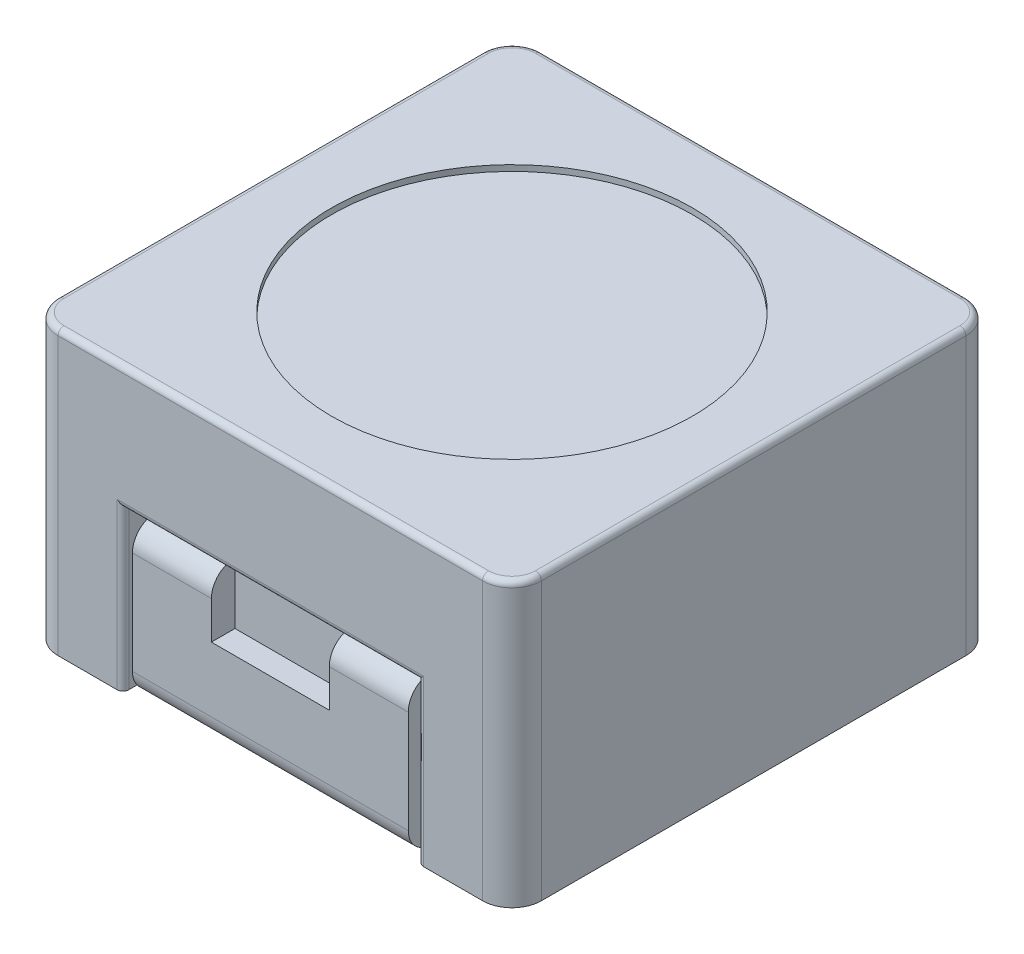
from build123d import *

# Parameters (mm, degrees)
SKETCH_1_W           = 4.1
SKETCH_1_H           = 4.1
EXTRUDE_1_DEPTH      = 2.4
SKETCH_2_W           = 2.5
SKETCH_2_H           = 2.7
CUT_EXTRUDE_1_DEPTH  = 0.2
SKETCH_3_W           = 2.5
SKETCH_3_H           = 0.3
CUT_EXTRUDE_2_DEPTH  = 1.2
SKETCH_4_W           = 2.5
SKETCH_4_H           = 2.7
CUT_EXTRUDE_3_DEPTH  = 0.2
SKETCH_5_W           = 2.5
SKETCH_5_H           = 0.4
CUT_EXTRUDE_4_DEPTH  = 1.2
SKETCH_6_R           = 1.531140145
CUT_EXTRUDE_6_DEPTH  = 0.05
FILLET_3_R           = 0.05
FILLET_4_R           = 0.25
EXTRUDE_2_DEPTH      = 0.2
EXTRUDE_2_DEPTH_BACK = 1.15
EXTRUDE_3_DEPTH      = 0.2
EXTRUDE_3_DEPTH_BACK = 1.15
FILLET_7_R           = 0.2
FILLET_8_R           = 0.2


# Some blends are built 0.0001 mm under size
with BuildPart() as part:
    # Эскиз1 → Бобышка-Вытянуть1 (new body)
    with BuildSketch(Plane(origin=(0, 0, 0), x_dir=(1, 0, 0), z_dir=(0, 1, 0))):
        Rectangle(SKETCH_1_W, SKETCH_1_H)
    extrude(amount=EXTRUDE_1_DEPTH)

    # Эскиз2 → Вырез-Вытянуть1 (cut)
    with BuildSketch(Plane.XY.offset(2.05)):
        Rectangle(SKETCH_2_W, SKETCH_2_H)
    extrude(amount=-CUT_EXTRUDE_1_DEPTH, mode=Mode.SUBTRACT)

    # Эскиз3 → Вырез-Вытянуть2 (cut)
    with BuildSketch(Plane.XY.offset(1.85)):
        Rectangle(SKETCH_3_W, SKETCH_3_H)
    extrude(amount=-CUT_EXTRUDE_2_DEPTH, mode=Mode.SUBTRACT)

    # Эскиз4 → Вырез-Вытянуть3 (cut)
    with BuildSketch(Plane(origin=(0, 0, -2.05), x_dir=(-1, 0, 0), z_dir=(0, 0, -1))):
        Rectangle(SKETCH_4_W, SKETCH_4_H)
    extrude(amount=-CUT_EXTRUDE_3_DEPTH, mode=Mode.SUBTRACT)

    # Эскиз5 → Вырез-Вытянуть4 (cut)
    with BuildSketch(Plane(origin=(0, 0, -1.85), x_dir=(-1, 0, 0), z_dir=(0, 0, -1))):
        Rectangle(SKETCH_5_W, SKETCH_5_H)
    extrude(amount=-CUT_EXTRUDE_4_DEPTH, mode=Mode.SUBTRACT)

    # Эскиз6 → Вырез-Вытянуть6 (cut)
    with BuildSketch(Plane(origin=(0, 2.4, 0), x_dir=(1, 0, 0), z_dir=(0, 1, 0))):
        with Locations(Location((0, 0, 0), (0, 0, 270))):
            Circle(SKETCH_6_R)
    extrude(amount=-CUT_EXTRUDE_6_DEPTH, mode=Mode.SUBTRACT)

    # Скругление3
    fillet_3_edges = [part.edges().sort_by_distance(p)[0] for p in [
        (-2.05, 2.4, 0),
        (0, 2.4, 2.05),
        (-1.25, 0.675, 2.05),
        (1.25, 0.675, 2.05),
        (0, 1.35, 2.05),
        (2.05, 2.4, 0),
        (1.25, 0.675, -2.05),
        (-1.25, 0.675, -2.05),
        (0, 1.35, -2.05),
        (0, 2.4, -2.05),
    ]]
    fillet(fillet_3_edges, radius=FILLET_3_R)

    # Скругление4
    # the kernel refuses this fillet: 0.25 mm, written as the material it takes off along each edge
    with BuildSketch(Plane(origin=(1.8, 2.4, 1.8), x_dir=(0, 0, 1), z_dir=(-1, 0, 0))) as fillet_4_piece_1:
        with BuildLine():
            CenterArc((0.2, -0.05), 0.05, 0, 90)
            Line((0.25, -0.05), (0.25, 0))
            Line((0.25, 0), (0.2, 0))
        make_face()
    revolve(axis=Axis((1.8, 2.4, 1.8), (0, 1, 0)), revolution_arc=90, mode=Mode.SUBTRACT)
    with BuildSketch(Plane(origin=(-1.8, 2.4, 1.8), x_dir=(-1, 0, 0), z_dir=(0, 0, -1))) as fillet_4_piece_2:
        with BuildLine():
            CenterArc((0.2, -0.05), 0.05, 0, 90)
            Line((0.25, -0.05), (0.25, 0))
            Line((0.25, 0), (0.2, 0))
        make_face()
    revolve(axis=Axis((-1.8, 2.4, 1.8), (0, 1, 0)), revolution_arc=90, mode=Mode.SUBTRACT)
    with BuildSketch(Plane(origin=(1.8, 2.4, -1.8), x_dir=(1, 0, 0), z_dir=(0, 0, 1))) as fillet_4_piece_3:
        with BuildLine():
            CenterArc((0.2, -0.05), 0.05, 0, 90)
            Line((0.25, -0.05), (0.25, 0))
            Line((0.25, 0), (0.2, 0))
        make_face()
    revolve(axis=Axis((1.8, 2.4, -1.8), (0, 1, 0)), revolution_arc=90, mode=Mode.SUBTRACT)
    with BuildSketch(Plane(origin=(-1.8, 2.4, -1.8), x_dir=(0, 0, -1), z_dir=(1, 0, 0))) as fillet_4_piece_4:
        with BuildLine():
            CenterArc((0.2, -0.05), 0.05, 0, 90)
            Line((0.25, -0.05), (0.25, 0))
            Line((0.25, 0), (0.2, 0))
        make_face()
    revolve(axis=Axis((-1.8, 2.4, -1.8), (0, 1, 0)), revolution_arc=90, mode=Mode.SUBTRACT)
    with BuildSketch(Plane(origin=(2.05, -0.625, 2.05), x_dir=(-1, 0, 0), z_dir=(0, 1, 0)), Plane(origin=(2.05, -0.625, -2.05), x_dir=(0, 0, 1), z_dir=(0, 1, 0))) as fillet_4_piece_5:
        with BuildLine():
            CenterArc((FILLET_4_R, -FILLET_4_R), FILLET_4_R, 90, 90)
            Line((0, -FILLET_4_R), (0, 0))
            Line((0, 0), (FILLET_4_R, 0))
        make_face()
    extrude(amount=3.025, mode=Mode.SUBTRACT)
    with BuildSketch(Plane(origin=(-2.05, -0.625, 2.05), x_dir=(1, 0, 0), z_dir=(0, 1, 0)), Plane(origin=(-2.05, -0.625, -2.05), x_dir=(0, 0, 1), z_dir=(0, 1, 0))) as fillet_4_piece_6:
        with BuildLine():
            CenterArc((FILLET_4_R, FILLET_4_R), FILLET_4_R, 180, 90)
            Line((0, FILLET_4_R), (0, 0))
            Line((0, 0), (FILLET_4_R, 0))
        make_face()
    extrude(amount=3.025, mode=Mode.SUBTRACT)

    # Эскиз10 → Бобышка-Вытянуть3 (add, two sides: drawn at the far end of the back side and taken through both)
    with BuildSketch(Plane.XY.offset(1.85).offset(-EXTRUDE_3_DEPTH_BACK)):
        Polygon((-1.17, 0), (-1.17, 1.27), (-0.5, 1.27), (-0.5, 0.75), (0.5, 0.75), (0.5, 1.27), (1.17, 1.27), (1.17, 0.2), (1.17, 0), align=None)
    extrude(amount=EXTRUDE_3_DEPTH + EXTRUDE_3_DEPTH_BACK)

    # Скругление7
    fillet_7_edges = [part.edges().sort_by_distance(p)[0] for p in [
        (0, 0, 2.05),
        (-0.835, 1.27, 2.05),
        (0.835, 1.27, 2.05),
    ]]
    fillet(fillet_7_edges, radius=FILLET_7_R - 0.0001)  # a hair under: the kernel refuses the full size


with BuildPart() as body_2:
    # Эскиз8 → Бобышка-Вытянуть2 (new, two sides: drawn at the far end of the back side and taken through both)
    with BuildSketch(Plane(origin=(0, 0, -1.85), x_dir=(-1, 0, 0), z_dir=(0, 0, -1)).offset(-EXTRUDE_2_DEPTH_BACK)):
        Polygon((-1.17, 0), (-1.17, 1.266443577), (-0.5, 1.266443577), (-0.5, 0.75), (0.5, 0.75), (0.5, 1.27), (1.17, 1.27), (1.17, 0.2), (1.17, 0), align=None)
    extrude(amount=EXTRUDE_2_DEPTH + EXTRUDE_2_DEPTH_BACK)

    # Скругление8
    fillet_8_edges = [body_2.edges().sort_by_distance(p)[0] for p in [
        (0, 0, -2.05),
        (-0.835, 1.27, -2.05),
        (0.835, 1.266443577, -2.05),
    ]]
    fillet(fillet_8_edges, radius=FILLET_8_R)


solid = Compound([part.part, body_2.part])
